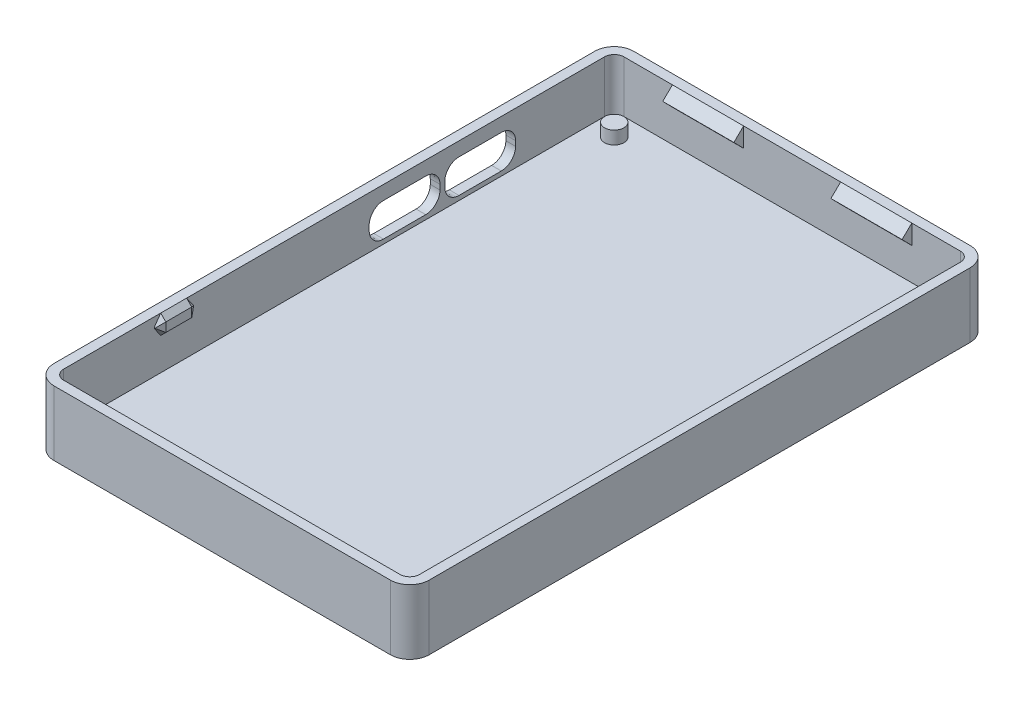
from build123d import *

# Parameters (mm, degrees)
EXTRUDE_1_DEPTH     = 2
EXTRUDE_2_DEPTH     = 11
SKETCH_5_R          = 1.5
EXTRUDE_3_DEPTH     = 2
CUT_EXTRUDE_START   = -3
CUT_EXTRUDE_2_DEPTH = 3
SKETCH_8_W          = 11
SKETCH_8_H          = 3
EXTRUDE_4_DEPTH     = 1.5
CUT_EXTRUDE_3_DEPTH = 40
SKETCH_11_W         = 6
SKETCH_11_H         = 3
EXTRUDE_5_DEPTH     = 1.5
CUT_EXTRUDE_4_DEPTH = 7
SKETCH_13_W         = 6
SKETCH_13_H         = 3
EXTRUDE_6_DEPTH     = 1.5
CUT_EXTRUDE_5_DEPTH = 7
CHAMFER_1_SIZE      = 1
CHAMFER_2_SIZE      = 1
CUT_EXTRUDE_6_DEPTH = 2


with BuildPart() as part:
    # 草图1 → 凸台-拉伸1 (new body)
    with BuildSketch(Plane(origin=(0, 0, 0), x_dir=(1, 0, 0), z_dir=(0, 1, 0))):
        with BuildLine():
            Line((3, 0), (55, 0))
            ThreePointArc((55, 0), (57.121320344, 0.878679656), (58, 3))
            Line((58, 3), (58, 86.6))
            ThreePointArc((58, 86.6), (57.121320344, 88.721320344), (55, 89.6))
            Line((55, 89.6), (3, 89.6))
            ThreePointArc((3, 89.6), (0.878679656, 88.721320344), (0, 86.6))
            Line((0, 86.6), (0, 3))
            ThreePointArc((0, 3), (0.878679656, 0.878679656), (3, 0))
        make_face()
    extrude(amount=EXTRUDE_1_DEPTH)

    # 草图3 → 凸台-拉伸2 (add)
    with BuildSketch(Plane(origin=(0, 2, 0), x_dir=(1, 0, 0), z_dir=(0, 1, 0))):
        with BuildLine():
            Line((0, 86.6), (0, 3))
            ThreePointArc((0, 3), (0.878679656, 0.878679656), (3, 0))
            Line((3, 0), (55, 0))
            ThreePointArc((55, 0), (57.121320344, 0.878679656), (58, 3))
            Line((58, 3), (58, 86.6))
            ThreePointArc((58, 86.6), (57.121320344, 88.721320344), (55, 89.6))
            Line((55, 89.6), (3, 89.6))
            ThreePointArc((3, 89.6), (0.878679656, 88.721320344), (0, 86.6))
        make_face()
        with BuildLine():
            Line((1.5, 86.6), (1.5, 3))
            ThreePointArc((1.5, 3), (1.939339828, 1.939339828), (3, 1.5))
            Line((3, 1.5), (55, 1.5))
            ThreePointArc((55, 1.5), (56.060660172, 1.939339828), (56.5, 3))
            Line((56.5, 3), (56.5, 86.6))
            ThreePointArc((56.5, 86.6), (56.060660172, 87.660660172), (55, 88.1))
            Line((55, 88.1), (3, 88.1))
            ThreePointArc((3, 88.1), (1.939339828, 87.660660172), (1.5, 86.6))
        make_face(mode=Mode.SUBTRACT)
    extrude(amount=EXTRUDE_2_DEPTH)

    # 草图5 → 凸台-拉伸3 (add)
    with BuildSketch(Plane(origin=(0, 2, 0), x_dir=(1, 0, 0), z_dir=(0, 1, 0))):
        with Locations(Location((5, 84.6, 0), (0, 0, 270))):
            Circle(SKETCH_5_R)
        with Locations(Location((53, 84.6, 0), (0, 0, 90))):
            Circle(SKETCH_5_R)
        with Locations(Location((53, 5, 0), (0, 0, 270))):
            Circle(SKETCH_5_R)
        with Locations(Location((5, 5, 0), (0, 0, 90))):
            Circle(SKETCH_5_R)
    extrude(amount=EXTRUDE_3_DEPTH)

    # 草图7 → 切除-拉伸2 (cut)
    with BuildSketch(Plane(origin=(0, 13, 0), x_dir=(1, 0, 0), z_dir=(0, 1, 0)).offset(CUT_EXTRUDE_START)):
        with BuildLine():
            Line((0, 86.6), (0, 3))
            ThreePointArc((0, 3), (0.878679656, 0.878679656), (3, 0))
            Line((3, 0), (55, 0))
            ThreePointArc((55, 0), (57.121320344, 0.878679656), (58, 3))
            Line((58, 3), (58, 86.6))
            ThreePointArc((58, 86.6), (57.121320344, 88.721320344), (55, 89.6))
            Line((55, 89.6), (3, 89.6))
            ThreePointArc((3, 89.6), (0.878679656, 88.721320344), (0, 86.6))
        make_face()
        with BuildLine():
            Line((3, 1.5), (55, 1.5))
            ThreePointArc((55, 1.5), (56.060660172, 1.939339828), (56.5, 3))
            Line((56.5, 3), (56.5, 86.6))
            ThreePointArc((56.5, 86.6), (56.060660172, 87.660660172), (55, 88.1))
            Line((55, 88.1), (3, 88.1))
            ThreePointArc((3, 88.1), (1.939339828, 87.660660172), (1.5, 86.6))
            Line((1.5, 86.6), (1.5, 3))
            ThreePointArc((1.5, 3), (1.939339828, 1.939339828), (3, 1.5))
        make_face(mode=Mode.SUBTRACT)
    extrude(amount=CUT_EXTRUDE_2_DEPTH, mode=Mode.SUBTRACT)

    # 草图8 → 凸台-拉伸4 (add)
    with BuildSketch(Plane.XY.offset(-88.1)):
        with Locations((16, 8.5)):
            Rectangle(SKETCH_8_W, SKETCH_8_H)
        with Locations((42, 8.5)):
            Rectangle(SKETCH_8_W, SKETCH_8_H)
    extrude(amount=EXTRUDE_4_DEPTH)

    # 草图10 → 切除-拉伸3 (cut)
    with BuildSketch(Plane.ZY.offset(-10.5)):
        Polygon((-86.6, 10), (-88.1, 10), (-86.6, 8.534338043), align=None)
        Polygon((-86.6, 7), (-86.6, 8.534338043), (-88.1, 7), align=None)
    extrude(amount=-CUT_EXTRUDE_3_DEPTH, mode=Mode.SUBTRACT)

    # 草图11 → 凸台-拉伸5 (add)
    with BuildSketch(Plane(origin=(1.5, 0, 0), x_dir=(0, 0, -1), z_dir=(1, 0, 0))):
        with Locations((20, 8.5)):
            Rectangle(SKETCH_11_W, SKETCH_11_H)
    extrude(amount=EXTRUDE_5_DEPTH)

    # 草图12 → 切除-拉伸4 (cut)
    with BuildSketch(Plane.XY.offset(-17)):
        Polygon((1.5, 10), (3, 8.5), (3, 10), align=None)
        Polygon((3, 7), (3, 8.5), (1.5, 7), align=None)
    extrude(amount=-CUT_EXTRUDE_4_DEPTH, mode=Mode.SUBTRACT)

    # 草图13 → 凸台-拉伸6 (add)
    with BuildSketch(Plane.ZY.offset(-56.5)):
        with Locations((-20, 8.5)):
            Rectangle(SKETCH_13_W, SKETCH_13_H)
    extrude(amount=EXTRUDE_6_DEPTH)

    # 草图15 → 切除-拉伸5 (cut)
    with BuildSketch(Plane(origin=(0, 0, -23), x_dir=(-1, 0, 0), z_dir=(0, 0, -1))):
        Polygon((-55, 10), (-56.5, 10), (-55, 8.5), align=None)
        Polygon((-55, 7), (-55, 8.5), (-56.5, 7), align=None)
    extrude(amount=-CUT_EXTRUDE_5_DEPTH, mode=Mode.SUBTRACT)

    # 倒角1
    # the kernel refuses this chamfer: 1 mm, written as the material it takes off along each edge
    with BuildSketch(Plane(origin=(2.057190958, 8.5, -17.666666667), x_dir=(0, -1, 0), z_dir=(0.816496580927726, 0, 0.5773502691896257)), Plane(origin=(2.057190958, 8.5, -22.333333333), x_dir=(-0.5, -0.4999999999999994, -0.707106781186548), z_dir=(0.816496580927726, 0, -0.5773502691896257))) as chamfer_1_piece_1:
        Polygon((-0.707106781, 0.40824829), (0.707106781, 0.40824829), (0, -0.816496581), align=None)
    extrude(amount=1.270170592, mode=Mode.SUBTRACT)
    with BuildSketch(Plane(origin=(3, 8.5, -14.428317012), x_dir=(-0.6873969152646603, 0.7262819568766866, 0), z_dir=(0, 0, -1))) as chamfer_1_piece_2:
        Polygon((CHAMFER_1_SIZE * 0.999621916911, -CHAMFER_1_SIZE * 0.0274958766106), (-CHAMFER_1_SIZE * 0.0274958766106, -CHAMFER_1_SIZE * 0.999621916911), (0, 0), align=None)
    extrude(amount=11.143365976, mode=Mode.SUBTRACT)
    with BuildSketch(Plane(origin=(4.81845448, 6.68154552, -23), x_dir=(0.019442520806014225, 0.019442520806014253, 0.9996219169112968), z_dir=(-0.707106781186548, 0.7071067811865471, 0))) as chamfer_1_piece_3_section:
        Polygon((CHAMFER_1_SIZE * 0.999621916911, -CHAMFER_1_SIZE * 0.0274958766106), (-CHAMFER_1_SIZE * 0.0274958766106, -CHAMFER_1_SIZE * 0.999621916911), (0, 0), align=None)
    chamfer_1_piece_3 = extrude(amount=7.264686319, mode=Mode.PRIVATE)
    chamfer_1_piece_3 = split(chamfer_1_piece_3, bisect_by=Plane(origin=(1.5, 8.929402981, -22.651130884), z_dir=(1, 0, 0)), keep=Keep.TOP, mode=Mode.PRIVATE)
    add(chamfer_1_piece_3, mode=Mode.SUBTRACT)
    with BuildSketch(Plane(origin=(-0.31845448, 11.81845448, -17), x_dir=(0.019442520806013688, 0.01944252080601371, -0.9996219169112968), z_dir=(0.707106781186548, -0.7071067811865471, 0))) as chamfer_1_piece_4_section:
        Polygon((CHAMFER_1_SIZE * 0.999621916911, -CHAMFER_1_SIZE * 0.0274958766106), (-CHAMFER_1_SIZE * 0.0274958766106, -CHAMFER_1_SIZE * 0.999621916911), (0, 0), align=None)
    chamfer_1_piece_4 = extrude(amount=7.264686319, mode=Mode.PRIVATE)
    chamfer_1_piece_4 = split(chamfer_1_piece_4, bisect_by=Plane(origin=(1.5, 8.929402981, -17.348869116), z_dir=(1, 0, 0)), keep=Keep.TOP, mode=Mode.PRIVATE)
    add(chamfer_1_piece_4, mode=Mode.SUBTRACT)
    with BuildSketch(Plane(origin=(-0.31845448, 5.18154552, -23), x_dir=(-0.7068394360706733, 0.7068394360706738, -0.027495876610585633), z_dir=(0.7071067811865477, 0.7071067811865474, 0))) as chamfer_1_piece_5_section:
        Polygon((CHAMFER_1_SIZE * 0.999621916911, CHAMFER_1_SIZE * 0.0274958766106), (-CHAMFER_1_SIZE * 0.0274958766106, CHAMFER_1_SIZE * 0.999621916911), (0, 0), align=None)
    chamfer_1_piece_5 = extrude(amount=7.264686319, mode=Mode.PRIVATE)
    chamfer_1_piece_5 = split(chamfer_1_piece_5, bisect_by=Plane(origin=(1.5, 8.070597019, -22.651130884), z_dir=(1, 0, 0)), keep=Keep.TOP, mode=Mode.PRIVATE)
    add(chamfer_1_piece_5, mode=Mode.SUBTRACT)
    with BuildSketch(Plane(origin=(4.81845448, 10.31845448, -17), x_dir=(0.019442520806014236, -0.019442520806014243, -0.9996219169112968), z_dir=(-0.7071067811865477, -0.7071067811865474, 0))) as chamfer_1_piece_6_section:
        Polygon((CHAMFER_1_SIZE * 0.999621916911, -CHAMFER_1_SIZE * 0.0274958766106), (-CHAMFER_1_SIZE * 0.0274958766106, -CHAMFER_1_SIZE * 0.999621916911), (0, 0), align=None)
    chamfer_1_piece_6 = extrude(amount=7.264686319, mode=Mode.PRIVATE)
    chamfer_1_piece_6 = split(chamfer_1_piece_6, bisect_by=Plane(origin=(1.5, 8.070597019, -17.348869116), z_dir=(1, 0, 0)), keep=Keep.TOP, mode=Mode.PRIVATE)
    add(chamfer_1_piece_6, mode=Mode.SUBTRACT)

    # 倒角2
    # the kernel refuses this chamfer: 1 mm, written as the material it takes off along each edge
    with BuildSketch(Plane(origin=(55.942809042, 8.5, -22.333333333), x_dir=(0, -1, 0), z_dir=(-0.8164965809277266, 0, -0.577350269189625)), Plane(origin=(55.942809042, 8.5, -17.666666667), x_dir=(0.49999999999999983, -0.4999999999999986, 0.7071067811865487), z_dir=(-0.8164965809277266, 0, 0.577350269189625))) as chamfer_2_piece_1:
        Polygon((-0.707106781, 0.40824829), (0.707106781, 0.40824829), (0, -0.816496581), align=None)
    extrude(amount=1.270170592, mode=Mode.SUBTRACT)
    with BuildSketch(Plane(origin=(55, 8.5, -25.571682988), x_dir=(0.6873969152646596, 0.7262819568766873, 0), z_dir=(0, 0, 1))) as chamfer_2_piece_2:
        Polygon((CHAMFER_2_SIZE * 0.999621916911, -CHAMFER_2_SIZE * 0.0274958766106), (-CHAMFER_2_SIZE * 0.0274958766106, -CHAMFER_2_SIZE * 0.999621916911), (0, 0), align=None)
    extrude(amount=11.143365976, mode=Mode.SUBTRACT)
    with BuildSketch(Plane(origin=(58.31845448, 11.81845448, -17), x_dir=(-0.01944252080601641, 0.019442520806016383, -0.9996219169112968), z_dir=(-0.7071067811865471, -0.707106781186548, 0))) as chamfer_2_piece_3_section:
        Polygon((CHAMFER_2_SIZE * 0.999621916911, CHAMFER_2_SIZE * 0.0274958766106), (-CHAMFER_2_SIZE * 0.0274958766106, CHAMFER_2_SIZE * 0.999621916911), (0, 0), align=None)
    chamfer_2_piece_3 = extrude(amount=7.264686319, mode=Mode.PRIVATE)
    chamfer_2_piece_3 = split(chamfer_2_piece_3, bisect_by=Plane(origin=(56.5, 8.929402981, -17.348869116), z_dir=(-1, 0, 0)), keep=Keep.TOP, mode=Mode.PRIVATE)
    add(chamfer_2_piece_3, mode=Mode.SUBTRACT)
    with BuildSketch(Plane(origin=(58.31845448, 11.81845448, -23), x_dir=(-0.01944252080601382, 0.019442520806013795, 0.9996219169112968), z_dir=(-0.7071067811865471, -0.707106781186548, 0))) as chamfer_2_piece_4_section:
        Polygon((CHAMFER_2_SIZE * 0.999621916911, -CHAMFER_2_SIZE * 0.0274958766106), (-CHAMFER_2_SIZE * 0.0274958766106, -CHAMFER_2_SIZE * 0.999621916911), (0, 0), align=None)
    chamfer_2_piece_4 = extrude(amount=7.264686319, mode=Mode.PRIVATE)
    chamfer_2_piece_4 = split(chamfer_2_piece_4, bisect_by=Plane(origin=(56.5, 8.929402981, -22.651130884), z_dir=(-1, 0, 0)), keep=Keep.TOP, mode=Mode.PRIVATE)
    add(chamfer_2_piece_4, mode=Mode.SUBTRACT)
    with BuildSketch(Plane(origin=(53.18154552, 10.31845448, -17), x_dir=(0.706839436070674, 0.7068394360706731, 0.0274958766105856), z_dir=(0.7071067811865471, -0.707106781186548, 0))) as chamfer_2_piece_5_section:
        Polygon((CHAMFER_2_SIZE * 0.999621916911, -CHAMFER_2_SIZE * 0.0274958766106), (-CHAMFER_2_SIZE * 0.0274958766106, -CHAMFER_2_SIZE * 0.999621916911), (0, 0), align=None)
    chamfer_2_piece_5 = extrude(amount=7.264686319, mode=Mode.PRIVATE)
    chamfer_2_piece_5 = split(chamfer_2_piece_5, bisect_by=Plane(origin=(56.5, 8.070597019, -17.348869116), z_dir=(-1, 0, 0)), keep=Keep.TOP, mode=Mode.PRIVATE)
    add(chamfer_2_piece_5, mode=Mode.SUBTRACT)
    with BuildSketch(Plane(origin=(53.18154552, 10.31845448, -23), x_dir=(-0.01944252080601641, -0.019442520806016383, 0.9996219169112968), z_dir=(0.7071067811865471, -0.707106781186548, 0))) as chamfer_2_piece_6_section:
        Polygon((CHAMFER_2_SIZE * 0.999621916911, -CHAMFER_2_SIZE * 0.0274958766106), (-CHAMFER_2_SIZE * 0.0274958766106, -CHAMFER_2_SIZE * 0.999621916911), (0, 0), align=None)
    chamfer_2_piece_6 = extrude(amount=7.264686319, mode=Mode.PRIVATE)
    chamfer_2_piece_6 = split(chamfer_2_piece_6, bisect_by=Plane(origin=(56.5, 8.070597019, -22.651130884), z_dir=(-1, 0, 0)), keep=Keep.TOP, mode=Mode.PRIVATE)
    add(chamfer_2_piece_6, mode=Mode.SUBTRACT)

    # 草图16 → 切除-拉伸6 (cut)
    # profile 1 of 4: a face of its own
    with BuildSketch(Plane(origin=(0, 2, -82.999537719), x_dir=(0, 1, 0), z_dir=(-1, 0, 0))):
        with BuildLine():
            add(Edge.make_bspline(
                [(3.650025513, -10.151031112), (3.92482832, -10.151031112), (4.462198601, -10.245555275), (5.25406566, -10.746990965), (5.755501349, -11.538858023), (5.850025513, -12.076228304), (5.850025513, -12.351031112)],
                knots=[0, 0, 0, 0, 0.25, 0.5, 0.75, 1, 1, 1, 1], degree=3))
            Line((5.850025513, -12.351031112), (5.850025513, -18.891031112))
            add(Edge.make_bspline(
                [(5.850025513, -18.891031112), (5.850025513, -19.165833919), (5.755501349, -19.7032042), (5.25406566, -20.495071258), (4.462198601, -20.996506948), (3.92482832, -21.091031112), (3.650025513, -21.091031112)],
                knots=[0, 0, 0, 0, 0.25, 0.5, 0.75, 1, 1, 1, 1], degree=3))
            Line((3.650025513, -21.091031112), (2.890025513, -21.091031112))
            add(Edge.make_bspline(
                [(2.890025513, -21.091031112), (2.615222706, -21.091031112), (2.077852425, -20.996506948), (1.285985366, -20.495071258), (0.784549677, -19.7032042), (0.690025513, -19.165833919), (0.690025513, -18.891031112)],
                knots=[0, 0, 0, 0, 0.25, 0.5, 0.75, 1, 1, 1, 1], degree=3))
            Line((0.690025513, -18.891031112), (0.690025513, -12.351031112))
            add(Edge.make_bspline(
                [(0.690025513, -12.351031112), (0.690025513, -12.076228304), (0.784549677, -11.538858023), (1.285985366, -10.746990965), (2.077852425, -10.245555275), (2.615222706, -10.151031112), (2.890025513, -10.151031112)],
                knots=[0, 0, 0, 0, 0.25, 0.5, 0.75, 1, 1, 1, 1], degree=3))
            Line((2.890025513, -10.151031112), (3.650025513, -10.151031112))
        make_face()
        with BuildLine():
            Line((2.890025513, -11.151031112), (3.650025513, -11.151031112))
            add(Edge.make_bspline(
                [(3.650025513, -11.151031112), (4.352969238, -11.151031112), (4.850025513, -11.648087386), (4.850025513, -12.351031112)],
                knots=[0, 0, 0, 0, 1, 1, 1, 1], degree=3, weights=[1, 0.804737854, 0.804737854, 1]))
            Line((4.850025513, -12.351031112), (4.850025513, -18.891031112))
            add(Edge.make_bspline(
                [(4.850025513, -18.891031112), (4.850025513, -19.593974837), (4.352969238, -20.091031112), (3.650025513, -20.091031112)],
                knots=[0, 0, 0, 0, 1, 1, 1, 1], degree=3, weights=[1, 0.804737854, 0.804737854, 1]))
            Line((3.650025513, -20.091031112), (2.890025513, -20.091031112))
            add(Edge.make_bspline(
                [(2.890025513, -20.091031112), (2.187081788, -20.091031112), (1.690025513, -19.593974837), (1.690025513, -18.891031112)],
                knots=[0, 0, 0, 0, 1, 1, 1, 1], degree=3, weights=[1, 0.804737854, 0.804737854, 1]))
            Line((1.690025513, -18.891031112), (1.690025513, -12.351031112))
            add(Edge.make_bspline(
                [(1.690025513, -12.351031112), (1.690025513, -11.648087386), (2.187081788, -11.151031112), (2.890025513, -11.151031112)],
                knots=[0, 0, 0, 0, 1, 1, 1, 1], degree=3, weights=[1, 0.804737854, 0.804737854, 1]))
        make_face(mode=Mode.SUBTRACT)
    # profile 2 of 4: a face of its own
    with BuildSketch(Plane(origin=(0, 2, -82.999537719), x_dir=(0, 1, 0), z_dir=(-1, 0, 0))):
        with BuildLine():
            add(Edge.make_bspline(
                [(3.650025513, -11.151031112), (4.352969238, -11.151031112), (4.850025513, -11.648087386), (4.850025513, -12.351031112)],
                knots=[0, 0, 0, 0, 1, 1, 1, 1], degree=3, weights=[1, 0.804737854, 0.804737854, 1]))
            Line((4.850025513, -12.351031112), (4.850025513, -18.891031112))
            add(Edge.make_bspline(
                [(4.850025513, -18.891031112), (4.850025513, -19.593974837), (4.352969238, -20.091031112), (3.650025513, -20.091031112)],
                knots=[0, 0, 0, 0, 1, 1, 1, 1], degree=3, weights=[1, 0.804737854, 0.804737854, 1]))
            Line((3.650025513, -20.091031112), (2.890025513, -20.091031112))
            add(Edge.make_bspline(
                [(2.890025513, -20.091031112), (2.187081788, -20.091031112), (1.690025513, -19.593974837), (1.690025513, -18.891031112)],
                knots=[0, 0, 0, 0, 1, 1, 1, 1], degree=3, weights=[1, 0.804737854, 0.804737854, 1]))
            Line((1.690025513, -18.891031112), (1.690025513, -12.351031112))
            add(Edge.make_bspline(
                [(1.690025513, -12.351031112), (1.690025513, -11.648087386), (2.187081788, -11.151031112), (2.890025513, -11.151031112)],
                knots=[0, 0, 0, 0, 1, 1, 1, 1], degree=3, weights=[1, 0.804737854, 0.804737854, 1]))
            Line((2.890025513, -11.151031112), (3.650025513, -11.151031112))
        make_face()
    # profile 3 of 4: a face of its own
    with BuildSketch(Plane(origin=(0, 2, -82.999537719), x_dir=(0, 1, 0), z_dir=(-1, 0, 0))):
        with BuildLine():
            add(Edge.make_bspline(
                [(3.650025513, -21.83505448), (3.92482832, -21.83505448), (4.462198601, -21.929578643), (5.25406566, -22.431014333), (5.755501349, -23.222881391), (5.850025513, -23.760251672), (5.850025513, -24.03505448)],
                knots=[0, 0, 0, 0, 0.25, 0.5, 0.75, 1, 1, 1, 1], degree=3))
            Line((5.850025513, -24.03505448), (5.850025513, -30.57505448))
            add(Edge.make_bspline(
                [(5.850025513, -30.57505448), (5.850025513, -30.849857287), (5.755501349, -31.387227568), (5.25406566, -32.179094626), (4.462198601, -32.680530316), (3.92482832, -32.77505448), (3.650025513, -32.77505448)],
                knots=[0, 0, 0, 0, 0.25, 0.5, 0.75, 1, 1, 1, 1], degree=3))
            Line((3.650025513, -32.77505448), (2.890025513, -32.77505448))
            add(Edge.make_bspline(
                [(2.890025513, -32.77505448), (2.615222706, -32.77505448), (2.077852425, -32.680530316), (1.285985366, -32.179094626), (0.784549677, -31.387227568), (0.690025513, -30.849857287), (0.690025513, -30.57505448)],
                knots=[0, 0, 0, 0, 0.25, 0.5, 0.75, 1, 1, 1, 1], degree=3))
            Line((0.690025513, -30.57505448), (0.690025513, -24.03505448))
            add(Edge.make_bspline(
                [(0.690025513, -24.03505448), (0.690025513, -23.760251672), (0.784549677, -23.222881391), (1.285985366, -22.431014333), (2.077852425, -21.929578643), (2.615222706, -21.83505448), (2.890025513, -21.83505448)],
                knots=[0, 0, 0, 0, 0.25, 0.5, 0.75, 1, 1, 1, 1], degree=3))
            Line((2.890025513, -21.83505448), (3.650025513, -21.83505448))
        make_face()
        with BuildLine():
            Line((2.890025513, -22.83505448), (3.650025513, -22.83505448))
            add(Edge.make_bspline(
                [(3.650025513, -22.83505448), (4.352969238, -22.83505448), (4.850025513, -23.332110755), (4.850025513, -24.03505448)],
                knots=[0, 0, 0, 0, 1, 1, 1, 1], degree=3, weights=[1, 0.804737854, 0.804737854, 1]))
            Line((4.850025513, -24.03505448), (4.850025513, -30.57505448))
            add(Edge.make_bspline(
                [(4.850025513, -30.57505448), (4.850025513, -31.277998205), (4.352969238, -31.77505448), (3.650025513, -31.77505448)],
                knots=[0, 0, 0, 0, 1, 1, 1, 1], degree=3, weights=[1, 0.804737854, 0.804737854, 1]))
            Line((3.650025513, -31.77505448), (2.890025513, -31.77505448))
            add(Edge.make_bspline(
                [(2.890025513, -31.77505448), (2.187081788, -31.77505448), (1.690025513, -31.277998205), (1.690025513, -30.57505448)],
                knots=[0, 0, 0, 0, 1, 1, 1, 1], degree=3, weights=[1, 0.804737854, 0.804737854, 1]))
            Line((1.690025513, -30.57505448), (1.690025513, -24.03505448))
            add(Edge.make_bspline(
                [(1.690025513, -24.03505448), (1.690025513, -23.332110755), (2.187081788, -22.83505448), (2.890025513, -22.83505448)],
                knots=[0, 0, 0, 0, 1, 1, 1, 1], degree=3, weights=[1, 0.804737854, 0.804737854, 1]))
        make_face(mode=Mode.SUBTRACT)
    # profile 4 of 4: a face of its own
    with BuildSketch(Plane(origin=(0, 2, -82.999537719), x_dir=(0, 1, 0), z_dir=(-1, 0, 0))):
        with BuildLine():
            add(Edge.make_bspline(
                [(3.650025513, -22.83505448), (4.352969238, -22.83505448), (4.850025513, -23.332110755), (4.850025513, -24.03505448)],
                knots=[0, 0, 0, 0, 1, 1, 1, 1], degree=3, weights=[1, 0.804737854, 0.804737854, 1]))
            Line((4.850025513, -24.03505448), (4.850025513, -30.57505448))
            add(Edge.make_bspline(
                [(4.850025513, -30.57505448), (4.850025513, -31.277998205), (4.352969238, -31.77505448), (3.650025513, -31.77505448)],
                knots=[0, 0, 0, 0, 1, 1, 1, 1], degree=3, weights=[1, 0.804737854, 0.804737854, 1]))
            Line((3.650025513, -31.77505448), (2.890025513, -31.77505448))
            add(Edge.make_bspline(
                [(2.890025513, -31.77505448), (2.187081788, -31.77505448), (1.690025513, -31.277998205), (1.690025513, -30.57505448)],
                knots=[0, 0, 0, 0, 1, 1, 1, 1], degree=3, weights=[1, 0.804737854, 0.804737854, 1]))
            Line((1.690025513, -30.57505448), (1.690025513, -24.03505448))
            add(Edge.make_bspline(
                [(1.690025513, -24.03505448), (1.690025513, -23.332110755), (2.187081788, -22.83505448), (2.890025513, -22.83505448)],
                knots=[0, 0, 0, 0, 1, 1, 1, 1], degree=3, weights=[1, 0.804737854, 0.804737854, 1]))
            Line((2.890025513, -22.83505448), (3.650025513, -22.83505448))
        make_face()
    extrude(amount=-CUT_EXTRUDE_6_DEPTH, mode=Mode.SUBTRACT)


solid = part.part
